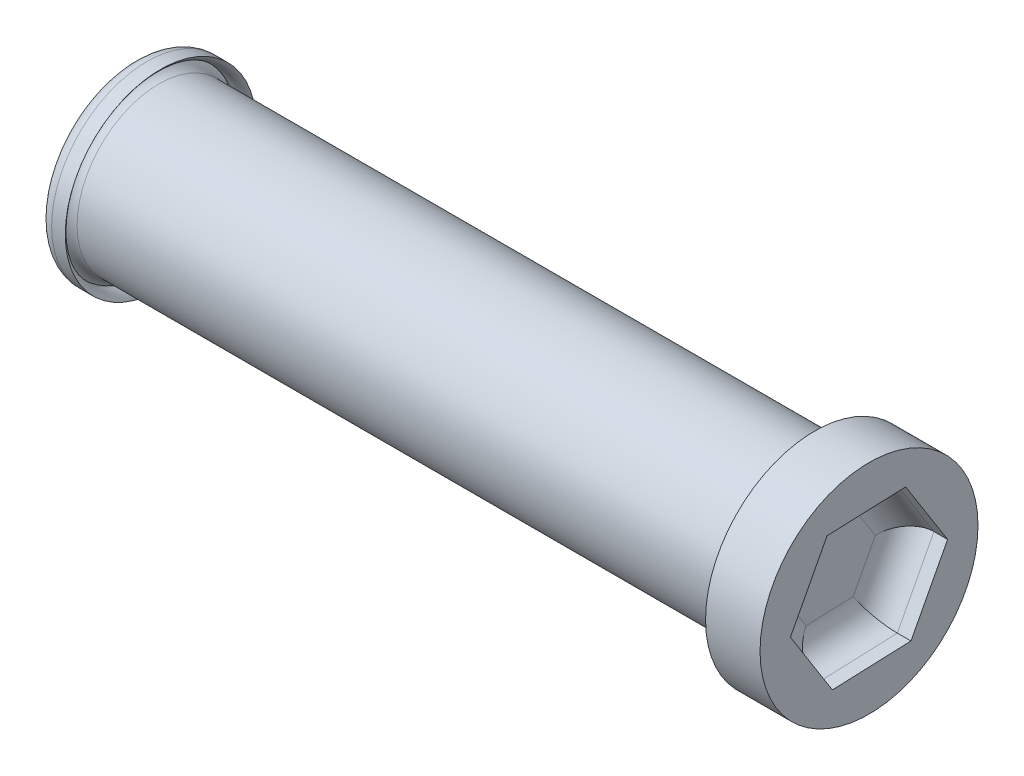
from build123d import *

# Parameters (mm, degrees)
ESBO_O4_R                = 3
RESSALTO_EXTRUS_O1_DEPTH = 24
CORTE_EXTRUS_O1_DEPTH    = 1.5
ESBO_O6_R                = 3.5
RESSALTO_EXTRUS_O2_DEPTH = 1
ESBO_O7_R                = 2.5
CORTE_EXTRUS_O2_DEPTH    = 1
ESBO_O8_R                = 3.25
ESBO_O8_R_2              = 3.0000000000000004
CORTE_EXTRUS_O3_DEPTH    = 0.5
FILETE2_R                = 0.5
FILETE3_R                = 1


with BuildPart() as part:
    # Esboço1 → Revolução3 (revolve)
    with BuildSketch(Plane.XY, mode=Mode.PRIVATE) as revolu_o3_sk:
        Polygon((0, 0), (4.3e-16, 4), (2.0000000000000004, 4), (2, 0), align=None)
    revolve(revolu_o3_sk.sketch.rotate(Axis((2, 0, 0), (-1, 0, 0)), 90), axis=Axis((2, 0, 0), (-1, 0, 0)))

    # Esboço4 → Ressalto-extrusão1 (add)
    with BuildSketch(Plane.ZY):
        with Locations(Location((0, 0, 0), (0, 0, 180))):
            Circle(ESBO_O4_R)
    extrude(amount=RESSALTO_EXTRUS_O1_DEPTH)

    # Esboço5 → Corte-extrusão1 (cut)
    with BuildSketch(Plane(origin=(2, 0, 0), x_dir=(0, 0, -1), z_dir=(1, 0, 0))):
        Polygon((1.3444941418500793, 2.554538869515231), (-1.5400484850299316, 2.441635516839142), (-2.88454262688001, -0.11290335267608817), (-1.3444941418500784, -2.5545388695152305), (1.540048485029931, -2.4416355168391424), (2.8845426268800107, 0.11290335267608934), align=None)
    extrude(amount=-CORTE_EXTRUS_O1_DEPTH, mode=Mode.SUBTRACT)

    # Esboço6 → Ressalto-extrusão2 (add)
    with BuildSketch(Plane.ZY.offset(24)):
        Circle(ESBO_O6_R)
    extrude(amount=RESSALTO_EXTRUS_O2_DEPTH)

    # Esboço7 → Corte-extrusão2 (cut)
    with BuildSketch(Plane.ZY.offset(25)):
        Circle(ESBO_O7_R)
    extrude(amount=-CORTE_EXTRUS_O2_DEPTH, mode=Mode.SUBTRACT)

    # Esboço8 → Corte-extrusão3 (cut)
    with BuildSketch(Plane(origin=(-24, 0, 0), x_dir=(0, 0, -1), z_dir=(1, 0, 0))):
        Circle(ESBO_O8_R)
        Circle(ESBO_O8_R_2, mode=Mode.SUBTRACT)
    extrude(amount=-CORTE_EXTRUS_O3_DEPTH, mode=Mode.SUBTRACT)

    # Filete2
    # the kernel refuses this fillet: 0.5 mm, written as the material it adds along each edge
    with BuildSketch(Plane(origin=(-24, 0, 0), x_dir=(0, 0, 1), z_dir=(0, -1, 0))) as filete2_piece_1:
        with BuildLine():
            CenterArc((2.5 - FILETE2_R, FILETE2_R), FILETE2_R, 270, 90)
            Line((2.5 - FILETE2_R, 0), (2.5 - FILETE2_R, -FILETE2_R * 0.02))
            Line((2.5 - FILETE2_R, -FILETE2_R * 0.02), (2.5 + FILETE2_R * 0.02, -FILETE2_R * 0.02))
            Line((2.5 + FILETE2_R * 0.02, -FILETE2_R * 0.02), (2.5 + FILETE2_R * 0.02, FILETE2_R))
            Line((2.5 + FILETE2_R * 0.02, FILETE2_R), (2.5, FILETE2_R))
        make_face()
    revolve(axis=Axis((-24, 0, 0), (-1, 0, 0)))
    with BuildSketch(Plane(origin=(-24.5, 0, 0), x_dir=(0, 0, -1), z_dir=(0, -1, 0))) as filete2_piece_2:
        with BuildLine():
            CenterArc((3.5000000000000004, 0.4330127018922383), FILETE2_R, 180, 60.00000000000102)
            Line((3.0000000000000004, 0.4330127018922383), (2.9900000000000007, 0.4330127018922383))
            Line((2.9900000000000007, 0.4330127018922383), (2.9900000000000007, 0))
            Line((2.9900000000000007, 0), (3.0000000000000004, -0.01000000000000156))
            ThreePointArc((3.0000000000000004, -0.01000000000000156), (3.1250000000000044, -0.01000000000000156), (3.2450000000000085, -0.00866025403783155))
            Line((3.2450000000000085, -0.00866025403783155), (3.2500000000000084, 1.421e-14))
        make_face()
    revolve(axis=Axis((-24.5, 0, 0), (1, 0, 0)))
    with BuildSketch(Plane(origin=(0, 0, 0), x_dir=(0, 1.2e-16, -1), z_dir=(0, 1, 1.2e-16))) as filete2_piece_3:
        with BuildLine():
            CenterArc((3 + FILETE2_R, FILETE2_R), FILETE2_R, 180, 90)
            Line((3 + FILETE2_R, -6e-17), (3 + FILETE2_R, -FILETE2_R * 0.02))
            Line((3 + FILETE2_R, -FILETE2_R * 0.02), (3 - FILETE2_R * 0.02, -FILETE2_R * 0.02))
            Line((3 - FILETE2_R * 0.02, -FILETE2_R * 0.02), (3 - FILETE2_R * 0.02, FILETE2_R))
            Line((3 - FILETE2_R * 0.02, FILETE2_R), (3, FILETE2_R))
        make_face()
    revolve(axis=Axis((0, 0, 0), (-1, 0, 0)))
    # the kernel refuses this fillet: 0.5 mm, written as the material it takes off along each edge
    with BuildSketch(Plane(origin=(-25, 0, 0), x_dir=(0, 0, 1), z_dir=(0, -1, 0))) as filete2_2_piece_1:
        with BuildLine():
            CenterArc((3.5 - FILETE2_R, -FILETE2_R), FILETE2_R, 0, 90)
            Line((3.5 - FILETE2_R, 0), (3.5 - FILETE2_R, FILETE2_R * 0.02))
            Line((3.5 - FILETE2_R, FILETE2_R * 0.02), (3.5 + FILETE2_R * 0.02, FILETE2_R * 0.02))
            Line((3.5 + FILETE2_R * 0.02, FILETE2_R * 0.02), (3.5 + FILETE2_R * 0.02, -FILETE2_R))
            Line((3.5 + FILETE2_R * 0.02, -FILETE2_R), (3.5, -FILETE2_R))
        make_face()
    revolve(axis=Axis((-25, 0, 0), (-1, 0, 0)), mode=Mode.SUBTRACT)
    with BuildSketch(Plane(origin=(-24, 0, 0), x_dir=(0, 0, -1), z_dir=(0, -1, 0))) as filete2_2_piece_2:
        with BuildLine():
            CenterArc((3.75, -0.4330127018922454), FILETE2_R, 119.99999999999864, 60.000000000001364)
            Line((3.25, -0.4330127018922454), (3.24, -0.4330127018922454))
            Line((3.24, -0.4330127018922454), (3.24, 0))
            Line((3.24, 0), (3.25, 0.01000000000000156))
            ThreePointArc((3.25, 0.01000000000000156), (3.3750000000000053, 0.01000000000000156), (3.495000000000011, 0.00866025403782444))
            Line((3.495000000000011, 0.00866025403782444), (3.500000000000011, -2.132e-14))
        make_face()
    revolve(axis=Axis((-24, 0, 0), (1, 0, 0)), mode=Mode.SUBTRACT)

    # Filete3
    filete3_edges = [part.edges().sort_by_distance(p)[0] for p in [
        (0.5, 1.3337211110956604, -2.114518384365045),
        (0.5, -1.1643660820815265, -2.212295555954971),
        (0.5, -2.498087193177186, -0.09777717158992649),
        (0.5, -1.3337211110956593, 2.114518384365044),
        (0.5, 1.164366082081527, 2.212295555954971),
        (0.5, 2.498087193177186, 0.09777717158992627),
    ]]
    fillet(filete3_edges, radius=FILETE3_R)


solid = part.part
